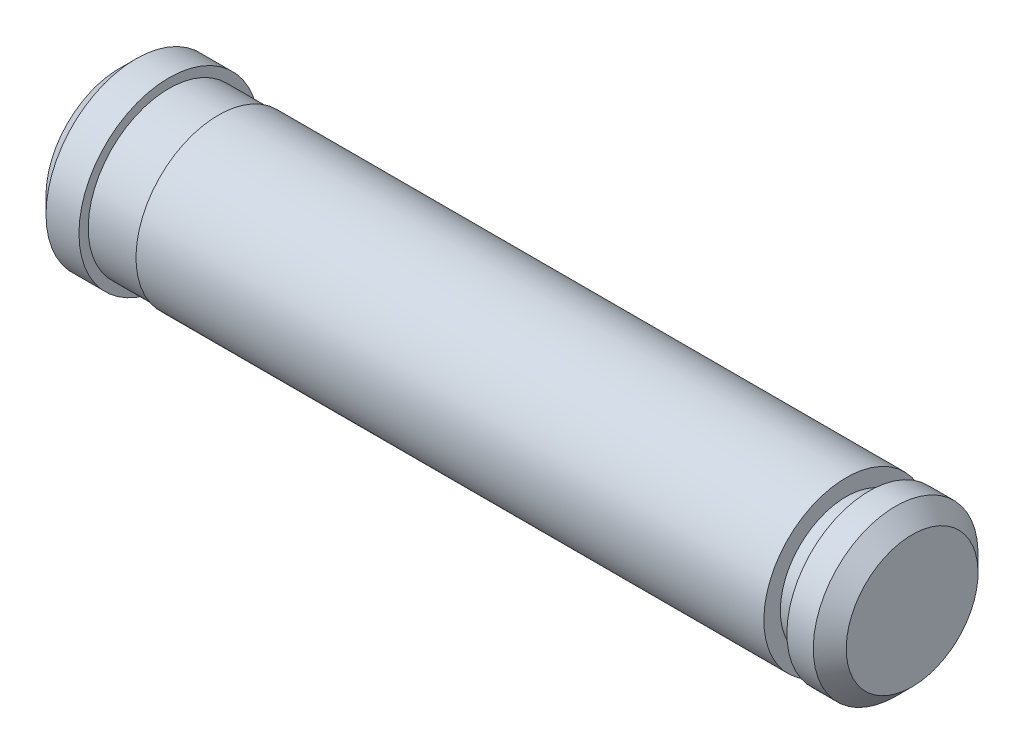
from build123d import *


with BuildPart() as part:
    # 草图1 → 旋转1 (revolve)
    with BuildSketch(Plane(origin=(0, 0, 0), x_dir=(-1, 0, 0), z_dir=(0, 0, -1))):
        Polygon((-44.872340426, 3.14893617), (-44.872340426, 0), (-7, 0), (-7, 3.512765957), (-7.787234043, 4.3), (-9.361702128, 4.3), (-9.361702128, 3.857446809), (-11.723404255, 3.857446809), (-11.723404255, 3.936170213), (-41.723404255, 3.936170213), (-41.723404255, 3.14893617), (-42.825531915, 3.14893617), (-42.825531915, 3.936170213), (-44.085106383, 3.936170213), align=None)
    revolve(axis=Axis((44.872340426, 0, 0), (-1, 0, 0)))


solid = part.part
